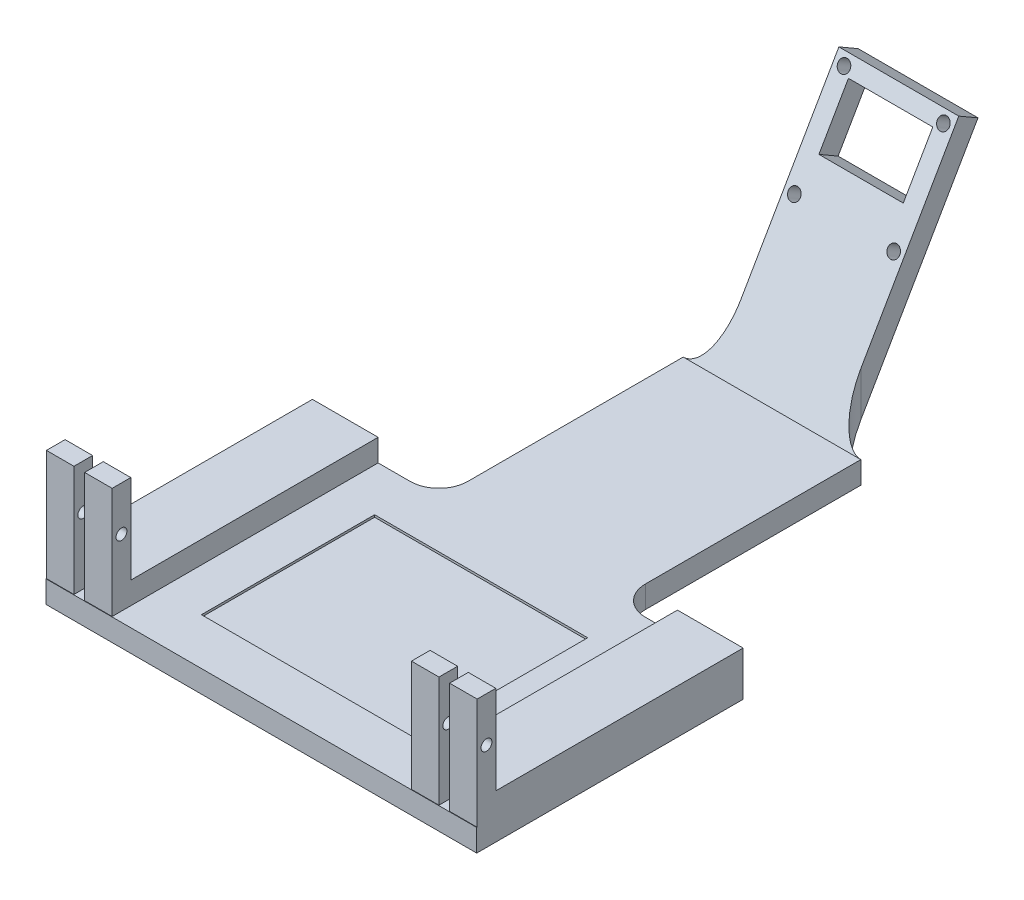
from build123d import *

# Parameters (mm, degrees)
BOSS_EXTRUDE1_DEPTH   = 6.35
SKETCH2_W             = 60.96
SKETCH2_H             = 49.53
CUT_EXTRUDE1_DEPTH    = 0.635
SKETCH5_W             = 7.874
SKETCH5_H             = 5.334
BOSS_EXTRUDE2_DEPTH   = 31.75
BOSS_EXTRUDE2_2_DEPTH = 31.75
SKETCH7_R             = 1.55575
CUT_EXTRUDE2_DEPTH    = 169.168334118
BOSS_EXTRUDE3_START   = -8.255
BOSS_EXTRUDE3_DEPTH   = 34.29
SKETCH9_R             = 1.7399
SKETCH9_W             = 24.13
SKETCH9_H             = 16.891
CUT_EXTRUDE3_DEPTH    = 175.333671147
SKETCH11_W            = 18.796
SKETCH11_H            = 70.745386066
BOSS_EXTRUDE6_DEPTH   = 6.35
FILLET1_R             = 8.255


with BuildPart() as part:
    # Sketch1 → Boss-Extrude1 (new body)
    with BuildSketch(Plane(origin=(0, 0, 0), x_dir=(1, 0, 0), z_dir=(0, 1, 0))):
        Polygon((-25.4, 38.1), (-61.595, 38.1), (-61.595, -38.1), (61.595, -38.1), (61.595, 38.1), (25.4, 38.1), (25.4, 107.95), (-25.4, 107.95), align=None)
    extrude(amount=BOSS_EXTRUDE1_DEPTH)

    # Sketch2 → Cut-Extrude1 (cut)
    with BuildSketch(Plane(origin=(0, 6.35, 0), x_dir=(1, 0, 0), z_dir=(0, 1, 0))):
        Rectangle(SKETCH2_W, SKETCH2_H)
    extrude(amount=-CUT_EXTRUDE1_DEPTH, mode=Mode.SUBTRACT)


with BuildPart() as body_2:
    # Sketch5 → Boss-Extrude2 (new body)
    with BuildSketch(Plane(origin=(0, 6.35, 0), x_dir=(1, 0, 0), z_dir=(0, 1, 0))):
        with Locations((-46.736, -35.312386066)):
            Rectangle(SKETCH5_W, SKETCH5_H)
    boss_extrude2 = extrude(amount=BOSS_EXTRUDE2_DEPTH)


with BuildPart() as body_3:
    # Sketch5 → Boss-Extrude2 2 (new body)
    with BuildSketch(Plane(origin=(0, 6.35, 0), x_dir=(1, 0, 0), z_dir=(0, 1, 0))):
        with Locations((-57.658, -35.312386066)):
            Rectangle(SKETCH5_W, SKETCH5_H)
    boss_extrude2_2 = extrude(amount=BOSS_EXTRUDE2_2_DEPTH)


with BuildPart() as part_1:
    add(part.part)

    # Mirror4: Boss-Extrude2, Boss-Extrude2 2 across plane
    add(boss_extrude2.mirror(Plane(origin=(0, 0, 0), x_dir=(0, 0, 1), z_dir=(1, 0, 0))))
    add(boss_extrude2_2.mirror(Plane(origin=(0, 0, 0), x_dir=(0, 0, 1), z_dir=(1, 0, 0))))


with BuildPart() as cut_extrude2_tool:
    # Sketch7 → Cut-Extrude2 (new, through all)
    with BuildSketch(Plane(origin=(61.595, 0, 0), x_dir=(0, 0, -1), z_dir=(1, 0, 0))):
        with Locations((-35.312386066, 25.4)):
            Circle(SKETCH7_R)
    extrude(amount=-CUT_EXTRUDE2_DEPTH)


with BuildPart() as part_2:
    add(part_1.part)

    # Cut-Extrude2: cut by cut_extrude2_tool
    add(cut_extrude2_tool.part, mode=Mode.SUBTRACT)

    # Sketch8 → Boss-Extrude3 (add)
    with BuildSketch(Plane(origin=(25.4, 0, 0), x_dir=(0, 0, -1), z_dir=(1, 0, 0)).offset(BOSS_EXTRUDE3_START)):
        Polygon((111.616174209, 0), (149.716174209, 65.991135768), (144.216912895, 69.166135768), (107.95, 6.35), (107.95, 0), align=None)
    extrude(amount=-BOSS_EXTRUDE3_DEPTH)

    # Sketch9 → Cut-Extrude3 (cut, through all)
    with BuildSketch(Plane(origin=(0, -45.156221169, -78.212869343), x_dir=(1, 0, 0), z_dir=(0, 0.49999999999997874, 0.866025403784451))):
        with Locations(Location((-14.2113, 129.074387105, 0), (0, 0, 270))):
            Circle(SKETCH9_R)
        with Locations(Location((14.2113, 129.074387105, 0), (0, 0, 90))):
            Circle(SKETCH9_R)
        with Locations(Location((14.2113, 100.651787105, 0), (0, 0, 270))):
            Circle(SKETCH9_R)
        with Locations(Location((-14.2113, 100.651787105, 0), (0, 0, 90))):
            Circle(SKETCH9_R)
        with Locations((0, 118.868787105)):
            Rectangle(SKETCH9_W, SKETCH9_H)
    extrude(amount=-CUT_EXTRUDE3_DEPTH, mode=Mode.SUBTRACT)



with BuildPart() as body_2_1:
    add(body_2.part)

    # Cut-Extrude2: cut by cut_extrude2_tool
    add(cut_extrude2_tool.part, mode=Mode.SUBTRACT)


with BuildPart() as body_3_1:
    add(body_3.part)

    # Cut-Extrude2: cut by cut_extrude2_tool
    add(cut_extrude2_tool.part, mode=Mode.SUBTRACT)


with BuildPart() as part_3:
    add(part_2.part)

    add(body_2_1.part)  # Boss-Extrude6 merges body 2

    add(body_3_1.part)  # Boss-Extrude6 merges body 3
    # Sketch11 → Boss-Extrude6 (add)
    with BuildSketch(Plane(origin=(0, 6.35, 0), x_dir=(1, 0, 0), z_dir=(0, 1, 0))):
        with Locations((-52.197, 2.727306967)):
            Rectangle(SKETCH11_W, SKETCH11_H)
        with Locations((52.197, 2.727306967)):
            Rectangle(SKETCH11_W, SKETCH11_H)
    extrude(amount=BOSS_EXTRUDE6_DEPTH)

    # Fillet1
    # the kernel refuses this fillet: 8.255 mm, written as the material it adds along each edge
    with BuildSketch(Plane(origin=(-17.145, 26.9875, -107.95), x_dir=(-1, 0, 0), z_dir=(0, -1, 0))) as fillet1_piece_1_section:
        with BuildLine():
            CenterArc((FILLET1_R, FILLET1_R), FILLET1_R, 180, 90)
            Line((0, FILLET1_R), (0, 0))
            Line((0, 0), (FILLET1_R, 0))
        make_face()
    fillet1_piece_1 = extrude(amount=26.9875, mode=Mode.PRIVATE)
    fillet1_piece_1 = split(fillet1_piece_1, bisect_by=Plane(origin=(-18.026106342, 6.35, -111.490654818), z_dir=(0, 1, 0)), keep=Keep.TOP, mode=Mode.PRIVATE)
    fillet1_piece_1 = split(fillet1_piece_1, bisect_by=Plane(origin=(-18.026106342, 10.193700171, -110.169161328), z_dir=(0, -0.4999999999999879, -0.8660254037844457)), keep=Keep.TOP, mode=Mode.PRIVATE)
    fillet1_piece_1 = split(fillet1_piece_1, bisect_by=Plane(origin=(-18.026106342, 7.018700171, -115.668422642), z_dir=(0, 0.49999999999999845, 0.8660254037844396)), keep=Keep.TOP, mode=Mode.PRIVATE)
    add(fillet1_piece_1)
    with BuildSketch(Plane(origin=(-17.145, 6.35, -107.95), x_dir=(-1, 0, 0), z_dir=(0, -1, 0))) as fillet1_piece_2_section:
        with BuildLine():
            CenterArc((FILLET1_R, FILLET1_R), FILLET1_R, 180, 90)
            Line((0, FILLET1_R), (0, 0))
            Line((0, 0), (FILLET1_R, 0))
        make_face()
    fillet1_piece_2 = extrude(amount=6.35, mode=Mode.PRIVATE)
    fillet1_piece_2 = split(fillet1_piece_2, bisect_by=Plane(origin=(-19.126244344, 4.717934574, -107.007726587), z_dir=(0, -0.4999999999999879, -0.8660254037844457)), keep=Keep.TOP, mode=Mode.PRIVATE)
    fillet1_piece_2 = split(fillet1_piece_2, bisect_by=Plane(origin=(-19.126244344, 1.542934574, -112.506987901), z_dir=(0, 0.49999999999999845, 0.8660254037844396)), keep=Keep.TOP, mode=Mode.PRIVATE)
    add(fillet1_piece_2)
    with BuildSketch(Plane(origin=(17.145, 26.9875, -107.95), x_dir=(1, 0, 0), z_dir=(0, -1, 0))) as fillet1_piece_3_section:
        with BuildLine():
            CenterArc((FILLET1_R, -FILLET1_R), FILLET1_R, 90, 90)
            Line((0, -FILLET1_R), (0, 0))
            Line((0, 0), (FILLET1_R, 0))
        make_face()
    fillet1_piece_3 = extrude(amount=26.9875, mode=Mode.PRIVATE)
    fillet1_piece_3 = split(fillet1_piece_3, bisect_by=Plane(origin=(18.026106342, 6.35, -111.490654818), z_dir=(0, 1, 0)), keep=Keep.TOP, mode=Mode.PRIVATE)
    fillet1_piece_3 = split(fillet1_piece_3, bisect_by=Plane(origin=(18.026106342, 10.193700171, -110.169161328), z_dir=(0, -0.4999999999999879, -0.8660254037844457)), keep=Keep.TOP, mode=Mode.PRIVATE)
    fillet1_piece_3 = split(fillet1_piece_3, bisect_by=Plane(origin=(18.026106342, 7.018700171, -115.668422642), z_dir=(0, 0.49999999999999845, 0.8660254037844396)), keep=Keep.TOP, mode=Mode.PRIVATE)
    add(fillet1_piece_3)
    with BuildSketch(Plane(origin=(17.145, 6.35, -107.95), x_dir=(1, 0, 0), z_dir=(0, -1, 0))) as fillet1_piece_4_section:
        with BuildLine():
            CenterArc((FILLET1_R, -FILLET1_R), FILLET1_R, 90, 90)
            Line((0, -FILLET1_R), (0, 0))
            Line((0, 0), (FILLET1_R, 0))
        make_face()
    fillet1_piece_4 = extrude(amount=6.35, mode=Mode.PRIVATE)
    fillet1_piece_4 = split(fillet1_piece_4, bisect_by=Plane(origin=(19.126244344, 4.717934574, -107.007726587), z_dir=(0, -0.4999999999999879, -0.8660254037844457)), keep=Keep.TOP, mode=Mode.PRIVATE)
    fillet1_piece_4 = split(fillet1_piece_4, bisect_by=Plane(origin=(19.126244344, 1.542934574, -112.506987901), z_dir=(0, 0.49999999999999845, 0.8660254037844396)), keep=Keep.TOP, mode=Mode.PRIVATE)
    add(fillet1_piece_4)
    with BuildSketch(Plane(origin=(-25.4, 0, -38.1), x_dir=(-1, 0, 0), z_dir=(0, 1, 0)), Plane(origin=(25.4, 0, -38.1), x_dir=(0, 0, -1), z_dir=(0, 1, 0))) as fillet1_piece_5:
        with BuildLine():
            CenterArc((FILLET1_R, -FILLET1_R), FILLET1_R, 90, 90)
            Line((0, -FILLET1_R), (0, 0))
            Line((0, 0), (FILLET1_R, 0))
        make_face()
    extrude(amount=6.35)


solid = part_3.part
